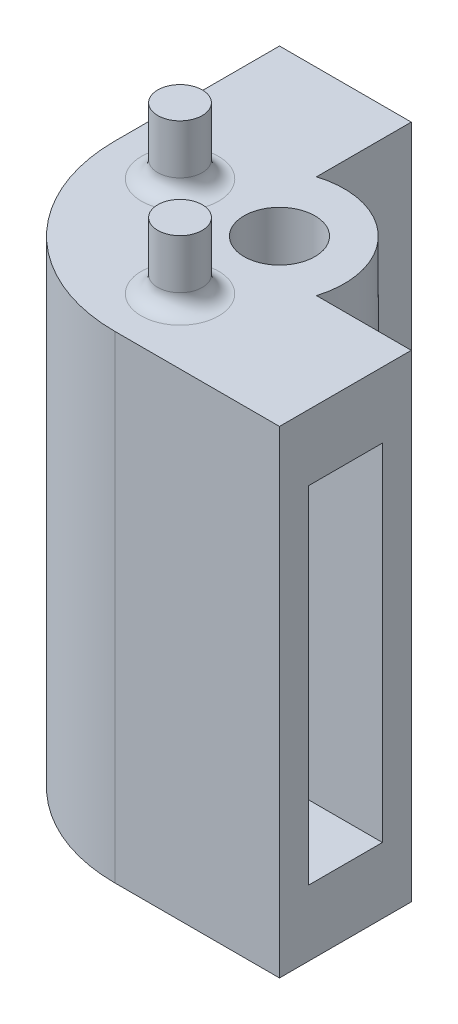
from build123d import *

# Parameters (mm, degrees)
BOSS_EXTRUDE1_DEPTH = 29
SKETCH3_W           = 4.5
SKETCH3_H           = 21
CUT_EXTRUDE1_DEPTH  = 6
SKETCH5_R           = 1.35
BOSS_EXTRUDE2_DEPTH = 4
FILLET1_R           = 1
SKETCH6_R           = 2.15
CUT_EXTRUDE2_DEPTH  = 41.509258201
CUT_EXTRUDE3_DEPTH  = 3.5


with BuildPart() as part:
    # Sketch2 → Boss-Extrude1 (new body)
    with BuildSketch(Plane(origin=(0, 0, 0), x_dir=(1, 0, 0), z_dir=(0, 1, 0))):
        with BuildLine():
            Line((0, 10), (0, 20))
            Line((0, 20), (8, 20))
            Line((8, 20), (8, 14.245191882))
            ThreePointArc((8, 14.245191882), (10.672752557, 14.316274399), (13, 13))
            Line((13, 13), (9.464466094, 9.464466094))
            Line((9.464466094, 9.464466094), (2.928932188, 2.928932188))
            ThreePointArc((2.928932188, 2.928932188), (0.761204675, 6.173165676), (0, 10))
        make_face()
    boss_extrude1 = extrude(amount=BOSS_EXTRUDE1_DEPTH)

    # Mirror1: Boss-Extrude1 across plane
    add(boss_extrude1.mirror(Plane(origin=(0, 0, 0), x_dir=(-0.707106781186546, 0, 0.707106781186549), z_dir=(0.707106781186549, 0, 0.707106781186546))))

    # Sketch3 → Cut-Extrude1 (cut)
    with BuildSketch(Plane(origin=(0, 0, -20), x_dir=(-1, 0, 0), z_dir=(0, 0, -1))):
        with Locations((-4, 14.5)):
            Rectangle(SKETCH3_W, SKETCH3_H)
    cut_extrude1 = extrude(amount=-CUT_EXTRUDE1_DEPTH, mode=Mode.SUBTRACT)

    # Mirror2: Cut-Extrude1 across plane
    add(cut_extrude1.mirror(Plane(origin=(0, 0, 0), x_dir=(-0.707106781186546, 0, 0.707106781186549), z_dir=(0.707106781186549, 0, 0.707106781186546))), mode=Mode.SUBTRACT)

    # Sketch5 → Boss-Extrude2 (add)
    with BuildSketch(Plane(origin=(0, 29, 0), x_dir=(1, 0, 0), z_dir=(0, 1, 0))):
        with Locations((9.999139198, 3.962062278)):
            Circle(SKETCH5_R)
        with Locations((3.962062278, 9.999139198)):
            Circle(SKETCH5_R)
    extrude(amount=BOSS_EXTRUDE2_DEPTH)

    # Fillet1
    fillet1_edges = [part.edges().sort_by_distance(p)[0] for p in [
        (2.612062278, 29, -9.999139198),
        (8.649139198, 29, -3.962062278),
    ]]
    fillet(fillet1_edges, radius=FILLET1_R)

    # Sketch6 → Cut-Extrude2 (cut, through all)
    with BuildSketch(Plane(origin=(0, 29, 0), x_dir=(1, 0, 0), z_dir=(0, 1, 0))):
        with Locations((10, 10)):
            Circle(SKETCH6_R)
    extrude(amount=-CUT_EXTRUDE2_DEPTH, mode=Mode.SUBTRACT)

    # Sketch9 → Cut-Extrude3 (cut)
    with BuildSketch(Plane(origin=(0, 24, 0), x_dir=(1, 0, 0), z_dir=(0, 1, 0))):
        Polygon((8.939052358, 13.959510504), (13.429036683, 18.44949483), (18.429313529, 13.762345089), (13.959510504, 8.939052358), (11.060947642, 6.040489496), (7.101437138, 7.101437138), (6.040489496, 11.060947642), align=None)
    cut_extrude3 = extrude(amount=-CUT_EXTRUDE3_DEPTH, mode=Mode.SUBTRACT)

    # Mirror4: Cut-Extrude3 across plane
    add(cut_extrude3.mirror(Plane.ZX.offset(14.5)), mode=Mode.SUBTRACT)


solid = part.part
